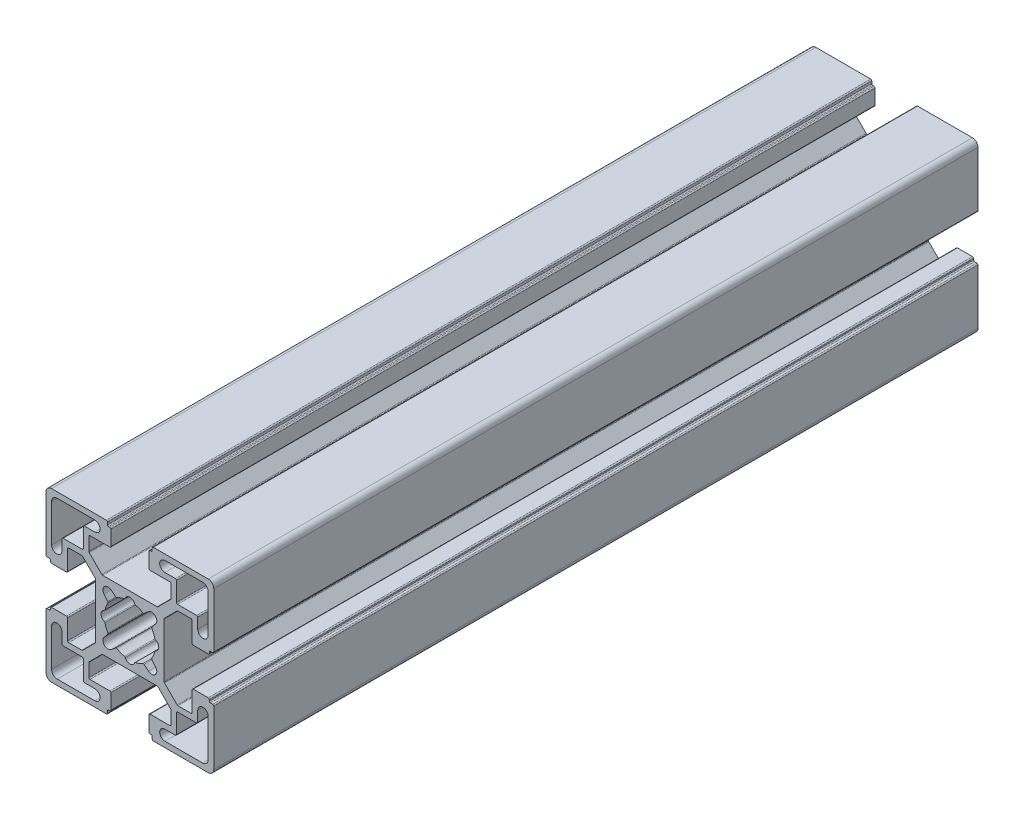
from build123d import *

# Parameters (mm, degrees)
RESSALTO_EXTRUS_O2_DEPTH = 205


with BuildPart() as part:
    # Sketch1 → Ressalto-extrusão2 (new body)
    with BuildSketch(Plane.XY):
        with BuildLine():
            ThreePointArc((22.2, 6), (22.412132034, 6.087867966), (22.5, 6.3))
            Line((22.5, 6.3), (22.5, 21))
            ThreePointArc((22.5, 21), (22.060660172, 22.060660172), (21, 22.5))
            Line((21, 22.5), (6.3, 22.5))
            ThreePointArc((6.3, 22.5), (6.087867966, 22.412132034), (6, 22.2))
            Line((6, 22.2), (6, 21.6))
            ThreePointArc((6, 21.6), (5.912132034, 21.387867966), (5.7, 21.3))
            Line((5.7, 21.3), (5.4, 21.3))
            ThreePointArc((5.4, 21.3), (5.187867966, 21.212132034), (5.1, 21))
            Line((5.1, 21), (5.1, 17))
            ThreePointArc((5.1, 17), (5.187867966, 16.787867966), (5.4, 16.7))
            Line((5.4, 16.7), (10.7, 16.7))
            ThreePointArc((10.7, 16.7), (10.912132034, 16.612132034), (11, 16.4))
            Line((11, 16.4), (11, 12.892031022))
            ThreePointArc((11, 12.892031022), (10.97716386, 12.777225992), (10.912132034, 12.679898987))
            Line((10.912132034, 12.679898987), (7.520101013, 9.287867966))
            ThreePointArc((7.520101013, 9.287867966), (7.422774008, 9.22283614), (7.307968978, 9.2))
            Line((7.307968978, 9.2), (-7.307968978, 9.2))
            ThreePointArc((-7.307968978, 9.2), (-7.422774008, 9.22283614), (-7.520101013, 9.287867966))
            Line((-7.520101013, 9.287867966), (-10.912132034, 12.679898987))
            ThreePointArc((-10.912132034, 12.679898987), (-10.97716386, 12.777225992), (-11, 12.892031022))
            Line((-11, 12.892031022), (-11, 16.4))
            ThreePointArc((-11, 16.4), (-10.912132034, 16.612132034), (-10.7, 16.7))
            Line((-10.7, 16.7), (-5.4, 16.7))
            ThreePointArc((-5.4, 16.7), (-5.187867966, 16.787867966), (-5.1, 17))
            Line((-5.1, 17), (-5.1, 21))
            ThreePointArc((-5.1, 21), (-5.187867966, 21.212132034), (-5.4, 21.3))
            Line((-5.4, 21.3), (-5.7, 21.3))
            ThreePointArc((-5.7, 21.3), (-5.912132034, 21.387867966), (-6, 21.6))
            Line((-6, 21.6), (-6, 22.2))
            ThreePointArc((-6, 22.2), (-6.087867966, 22.412132034), (-6.3, 22.5))
            Line((-6.3, 22.5), (-21, 22.5))
            ThreePointArc((-21, 22.5), (-22.060660172, 22.060660172), (-22.5, 21))
            Line((-22.5, 21), (-22.5, 6.3))
            ThreePointArc((-22.5, 6.3), (-22.412132034, 6.087867966), (-22.2, 6))
            Line((-22.2, 6), (-21.6, 6))
            ThreePointArc((-21.6, 6), (-21.387867966, 5.912132034), (-21.3, 5.7))
            Line((-21.3, 5.7), (-21.3, 5.4))
            ThreePointArc((-21.3, 5.4), (-21.212132034, 5.187867966), (-21, 5.1))
            Line((-21, 5.1), (-17, 5.1))
            ThreePointArc((-17, 5.1), (-16.787867966, 5.187867966), (-16.7, 5.4))
            Line((-16.7, 5.4), (-16.7, 10.7))
            ThreePointArc((-16.7, 10.7), (-16.612132034, 10.912132034), (-16.4, 11))
            Line((-16.4, 11), (-12.892031022, 11))
            ThreePointArc((-12.892031022, 11), (-12.777225992, 10.97716386), (-12.679898987, 10.912132034))
            Line((-12.679898987, 10.912132034), (-9.287867966, 7.520101013))
            ThreePointArc((-9.287867966, 7.520101013), (-9.22283614, 7.422774008), (-9.2, 7.307968978))
            Line((-9.2, 7.307968978), (-9.2, -7.307968978))
            ThreePointArc((-9.2, -7.307968978), (-9.22283614, -7.422774008), (-9.287867966, -7.520101013))
            Line((-9.287867966, -7.520101013), (-12.679898987, -10.912132034))
            ThreePointArc((-12.679898987, -10.912132034), (-12.777225992, -10.97716386), (-12.892031022, -11))
            Line((-12.892031022, -11), (-16.4, -11))
            ThreePointArc((-16.4, -11), (-16.612132034, -10.912132034), (-16.7, -10.7))
            Line((-16.7, -10.7), (-16.7, -5.4))
            ThreePointArc((-16.7, -5.4), (-16.787867966, -5.187867966), (-17, -5.1))
            Line((-17, -5.1), (-21, -5.1))
            ThreePointArc((-21, -5.1), (-21.212132034, -5.187867966), (-21.3, -5.4))
            Line((-21.3, -5.4), (-21.3, -5.7))
            ThreePointArc((-21.3, -5.7), (-21.387867966, -5.912132034), (-21.6, -6))
            Line((-21.6, -6), (-22.2, -6))
            ThreePointArc((-22.2, -6), (-22.412132034, -6.087867966), (-22.5, -6.3))
            Line((-22.5, -6.3), (-22.5, -21))
            ThreePointArc((-22.5, -21), (-22.060660172, -22.060660172), (-21, -22.5))
            Line((-21, -22.5), (-6.3, -22.5))
            ThreePointArc((-6.3, -22.5), (-6.087867966, -22.412132034), (-6, -22.2))
            Line((-6, -22.2), (-6, -21.6))
            ThreePointArc((-6, -21.6), (-5.912132034, -21.387867966), (-5.7, -21.3))
            Line((-5.7, -21.3), (-5.4, -21.3))
            ThreePointArc((-5.4, -21.3), (-5.187867966, -21.212132034), (-5.1, -21))
            Line((-5.1, -21), (-5.1, -17))
            ThreePointArc((-5.1, -17), (-5.187867966, -16.787867966), (-5.4, -16.7))
            Line((-5.4, -16.7), (-10.7, -16.7))
            ThreePointArc((-10.7, -16.7), (-10.912132034, -16.612132034), (-11, -16.4))
            Line((-11, -16.4), (-11, -12.892031022))
            ThreePointArc((-11, -12.892031022), (-10.97716386, -12.777225992), (-10.912132034, -12.679898987))
            Line((-10.912132034, -12.679898987), (-7.432233047, -9.2))
            Line((-7.432233047, -9.2), (7.307968978, -9.2))
            ThreePointArc((7.307968978, -9.2), (7.422774008, -9.22283614), (7.520101013, -9.287867966))
            Line((7.520101013, -9.287867966), (10.912132034, -12.679898987))
            ThreePointArc((10.912132034, -12.679898987), (10.97716386, -12.777225992), (11, -12.892031022))
            Line((11, -12.892031022), (11, -16.4))
            ThreePointArc((11, -16.4), (10.912132034, -16.612132034), (10.7, -16.7))
            Line((10.7, -16.7), (5.4, -16.7))
            ThreePointArc((5.4, -16.7), (5.187867966, -16.787867966), (5.1, -17))
            Line((5.1, -17), (5.1, -21))
            ThreePointArc((5.1, -21), (5.187867966, -21.212132034), (5.4, -21.3))
            Line((5.4, -21.3), (5.7, -21.3))
            ThreePointArc((5.7, -21.3), (5.912132034, -21.387867966), (6, -21.6))
            Line((6, -21.6), (6, -22.2))
            ThreePointArc((6, -22.2), (6.087867966, -22.412132034), (6.3, -22.5))
            Line((6.3, -22.5), (21, -22.5))
            ThreePointArc((21, -22.5), (22.060660172, -22.060660172), (22.5, -21))
            Line((22.5, -21), (22.5, -6.3))
            ThreePointArc((22.5, -6.3), (22.412132034, -6.087867966), (22.2, -6))
            Line((22.2, -6), (21.6, -6))
            ThreePointArc((21.6, -6), (21.387867966, -5.912132034), (21.3, -5.7))
            Line((21.3, -5.7), (21.3, -5.4))
            ThreePointArc((21.3, -5.4), (21.212132034, -5.187867966), (21, -5.1))
            Line((21, -5.1), (17, -5.1))
            ThreePointArc((17, -5.1), (16.787867966, -5.187867966), (16.7, -5.4))
            Line((16.7, -5.4), (16.7, -10.7))
            ThreePointArc((16.7, -10.7), (16.612132034, -10.912132034), (16.4, -11))
            Line((16.4, -11), (12.892031022, -11))
            ThreePointArc((12.892031022, -11), (12.777225992, -10.97716386), (12.679898987, -10.912132034))
            Line((12.679898987, -10.912132034), (9.287867966, -7.520101013))
            ThreePointArc((9.287867966, -7.520101013), (9.22283614, -7.422774008), (9.2, -7.307968978))
            Line((9.2, -7.307968978), (9.2, 7.307968978))
            ThreePointArc((9.2, 7.307968978), (9.22283614, 7.422774008), (9.287867966, 7.520101013))
            Line((9.287867966, 7.520101013), (12.679898987, 10.912132034))
            ThreePointArc((12.679898987, 10.912132034), (12.777225992, 10.97716386), (12.892031022, 11))
            Line((12.892031022, 11), (16.4, 11))
            ThreePointArc((16.4, 11), (16.612132034, 10.912132034), (16.7, 10.7))
            Line((16.7, 10.7), (16.7, 5.4))
            ThreePointArc((16.7, 5.4), (16.787867966, 5.187867966), (17, 5.1))
            Line((17, 5.1), (21, 5.1))
            ThreePointArc((21, 5.1), (21.212132034, 5.187867966), (21.3, 5.4))
            Line((21.3, 5.4), (21.3, 5.7))
            ThreePointArc((21.3, 5.7), (21.387867966, 5.912132034), (21.6, 6))
            Line((21.6, 6), (22.2, 6))
        make_face()
        with BuildLine():
            Line((-9.4, -21), (-19.5, -21))
            ThreePointArc((-19.5, -21), (-20.560660172, -20.560660172), (-21, -19.5))
            Line((-21, -19.5), (-21, -9.4))
            ThreePointArc((-21, -9.4), (-19.6, -8), (-18.2, -9.4))
            Line((-18.2, -9.4), (-18.2, -12.2))
            ThreePointArc((-18.2, -12.2), (-18.112132034, -12.412132034), (-17.9, -12.5))
            Line((-17.9, -12.5), (-12.8, -12.5))
            ThreePointArc((-12.8, -12.5), (-12.587867966, -12.587867966), (-12.5, -12.8))
            Line((-12.5, -12.8), (-12.5, -17.9))
            ThreePointArc((-12.5, -17.9), (-12.412132034, -18.112132034), (-12.2, -18.2))
            Line((-12.2, -18.2), (-9.4, -18.2))
            ThreePointArc((-9.4, -18.2), (-8, -19.6), (-9.4, -21))
        make_face(mode=Mode.SUBTRACT)
        with BuildLine():
            Line((12.8, -12.5), (17.9, -12.5))
            ThreePointArc((17.9, -12.5), (18.112132034, -12.412132034), (18.2, -12.2))
            Line((18.2, -12.2), (18.2, -9.4))
            ThreePointArc((18.2, -9.4), (19.6, -8), (21, -9.4))
            Line((21, -9.4), (21, -19.5))
            ThreePointArc((21, -19.5), (20.560660172, -20.560660172), (19.5, -21))
            Line((19.5, -21), (9.4, -21))
            ThreePointArc((9.4, -21), (8, -19.6), (9.4, -18.2))
            Line((9.4, -18.2), (12.2, -18.2))
            ThreePointArc((12.2, -18.2), (12.412132034, -18.112132034), (12.5, -17.9))
            Line((12.5, -17.9), (12.5, -12.8))
            ThreePointArc((12.5, -12.8), (12.587867966, -12.587867966), (12.8, -12.5))
        make_face(mode=Mode.SUBTRACT)
        with BuildLine():
            Line((-18.2, 12.2), (-18.2, 9.4))
            ThreePointArc((-18.2, 9.4), (-19.6, 8), (-21, 9.4))
            Line((-21, 9.4), (-21, 19.5))
            ThreePointArc((-21, 19.5), (-20.560660172, 20.560660172), (-19.5, 21))
            Line((-19.5, 21), (-9.4, 21))
            ThreePointArc((-9.4, 21), (-8, 19.6), (-9.4, 18.2))
            Line((-9.4, 18.2), (-12.2, 18.2))
            ThreePointArc((-12.2, 18.2), (-12.412132034, 18.112132034), (-12.5, 17.9))
            Line((-12.5, 17.9), (-12.5, 12.8))
            ThreePointArc((-12.5, 12.8), (-12.587867966, 12.587867966), (-12.8, 12.5))
            Line((-12.8, 12.5), (-17.9, 12.5))
            ThreePointArc((-17.9, 12.5), (-18.112132034, 12.412132034), (-18.2, 12.2))
        make_face(mode=Mode.SUBTRACT)
        with BuildLine():
            Line((-5.011190062, 6.911428437), (-3.818215474, 5.929763323))
            ThreePointArc((-3.818215474, 5.929763323), (-3.651033002, 5.862334174), (-3.475387346, 5.902896136))
            ThreePointArc((-3.475387346, 5.902896136), (-2.50834603, 6.374221536), (-1.479437798, 6.68833042))
            ThreePointArc((-1.479437798, 6.68833042), (-1.347716602, 6.754573553), (-1.263461477, 6.875568182))
            ThreePointArc((-1.263461477, 6.875568182), (0, 7.75), (1.263461477, 6.875568182))
            ThreePointArc((1.263461477, 6.875568182), (1.347716602, 6.754573553), (1.479437798, 6.68833042))
            ThreePointArc((1.479437798, 6.68833042), (2.50834603, 6.374221536), (3.475387346, 5.902896136))
            ThreePointArc((3.475387346, 5.902896136), (3.651033002, 5.862334174), (3.818215474, 5.929763323))
            Line((3.818215474, 5.929763323), (5.011190062, 6.911428437))
            ThreePointArc((5.011190062, 6.911428437), (6.823580438, 6.823580438), (6.911428437, 5.011190062))
            Line((6.911428437, 5.011190062), (5.929763323, 3.818215474))
            ThreePointArc((5.929763323, 3.818215474), (5.862334174, 3.651033002), (5.902896136, 3.475387346))
            ThreePointArc((5.902896136, 3.475387346), (6.374221536, 2.50834603), (6.68833042, 1.479437798))
            ThreePointArc((6.68833042, 1.479437798), (6.754573553, 1.347716602), (6.875568182, 1.263461477))
            ThreePointArc((6.875568182, 1.263461477), (7.75, 0), (6.875568182, -1.263461477))
            ThreePointArc((6.875568182, -1.263461477), (6.754573553, -1.347716602), (6.68833042, -1.479437798))
            ThreePointArc((6.68833042, -1.479437798), (6.374221536, -2.50834603), (5.902896136, -3.475387346))
            ThreePointArc((5.902896136, -3.475387346), (5.862334174, -3.651033002), (5.929763323, -3.818215474))
            Line((5.929763323, -3.818215474), (6.911428437, -5.011190062))
            ThreePointArc((6.911428437, -5.011190062), (6.823580438, -6.823580438), (5.011190062, -6.911428437))
            Line((5.011190062, -6.911428437), (3.818215474, -5.929763323))
            ThreePointArc((3.818215474, -5.929763323), (3.651033002, -5.862334174), (3.475387346, -5.902896136))
            ThreePointArc((3.475387346, -5.902896136), (2.50834603, -6.374221536), (1.479437798, -6.68833042))
            ThreePointArc((1.479437798, -6.68833042), (1.347716602, -6.754573553), (1.263461477, -6.875568182))
            ThreePointArc((1.263461477, -6.875568182), (0, -7.75), (-1.263461477, -6.875568182))
            ThreePointArc((-1.263461477, -6.875568182), (-1.347716602, -6.754573553), (-1.479437798, -6.68833042))
            ThreePointArc((-1.479437798, -6.68833042), (-2.50834603, -6.374221536), (-3.475387346, -5.902896136))
            ThreePointArc((-3.475387346, -5.902896136), (-3.651033002, -5.862334174), (-3.818215474, -5.929763323))
            Line((-3.818215474, -5.929763323), (-5.011190062, -6.911428437))
            ThreePointArc((-5.011190062, -6.911428437), (-6.823580438, -6.823580438), (-6.911428437, -5.011190062))
            Line((-6.911428437, -5.011190062), (-5.929763323, -3.818215474))
            ThreePointArc((-5.929763323, -3.818215474), (-5.862334174, -3.651033002), (-5.902896136, -3.475387346))
            ThreePointArc((-5.902896136, -3.475387346), (-6.374221536, -2.50834603), (-6.68833042, -1.479437798))
            ThreePointArc((-6.68833042, -1.479437798), (-6.754573553, -1.347716602), (-6.875568182, -1.263461477))
            ThreePointArc((-6.875568182, -1.263461477), (-7.75, 0), (-6.875568182, 1.263461477))
            ThreePointArc((-6.875568182, 1.263461477), (-6.754573553, 1.347716602), (-6.68833042, 1.479437798))
            ThreePointArc((-6.68833042, 1.479437798), (-6.374221536, 2.50834603), (-5.902896136, 3.475387346))
            ThreePointArc((-5.902896136, 3.475387346), (-5.862334174, 3.651033002), (-5.929763323, 3.818215474))
            Line((-5.929763323, 3.818215474), (-6.911428437, 5.011190062))
            ThreePointArc((-6.911428437, 5.011190062), (-6.823580438, 6.823580438), (-5.011190062, 6.911428437))
        make_face(mode=Mode.SUBTRACT)
        with BuildLine():
            Line((9.4, 21), (19.5, 21))
            ThreePointArc((19.5, 21), (20.560660172, 20.560660172), (21, 19.5))
            Line((21, 19.5), (21, 9.4))
            ThreePointArc((21, 9.4), (19.6, 8), (18.2, 9.4))
            Line((18.2, 9.4), (18.2, 12.2))
            ThreePointArc((18.2, 12.2), (18.112132034, 12.412132034), (17.9, 12.5))
            Line((17.9, 12.5), (12.8, 12.5))
            ThreePointArc((12.8, 12.5), (12.587867966, 12.587867966), (12.5, 12.8))
            Line((12.5, 12.8), (12.5, 17.9))
            ThreePointArc((12.5, 17.9), (12.412132034, 18.112132034), (12.2, 18.2))
            Line((12.2, 18.2), (9.4, 18.2))
            ThreePointArc((9.4, 18.2), (8, 19.6), (9.4, 21))
        make_face(mode=Mode.SUBTRACT)
    extrude(amount=RESSALTO_EXTRUS_O2_DEPTH)


solid = part.part
